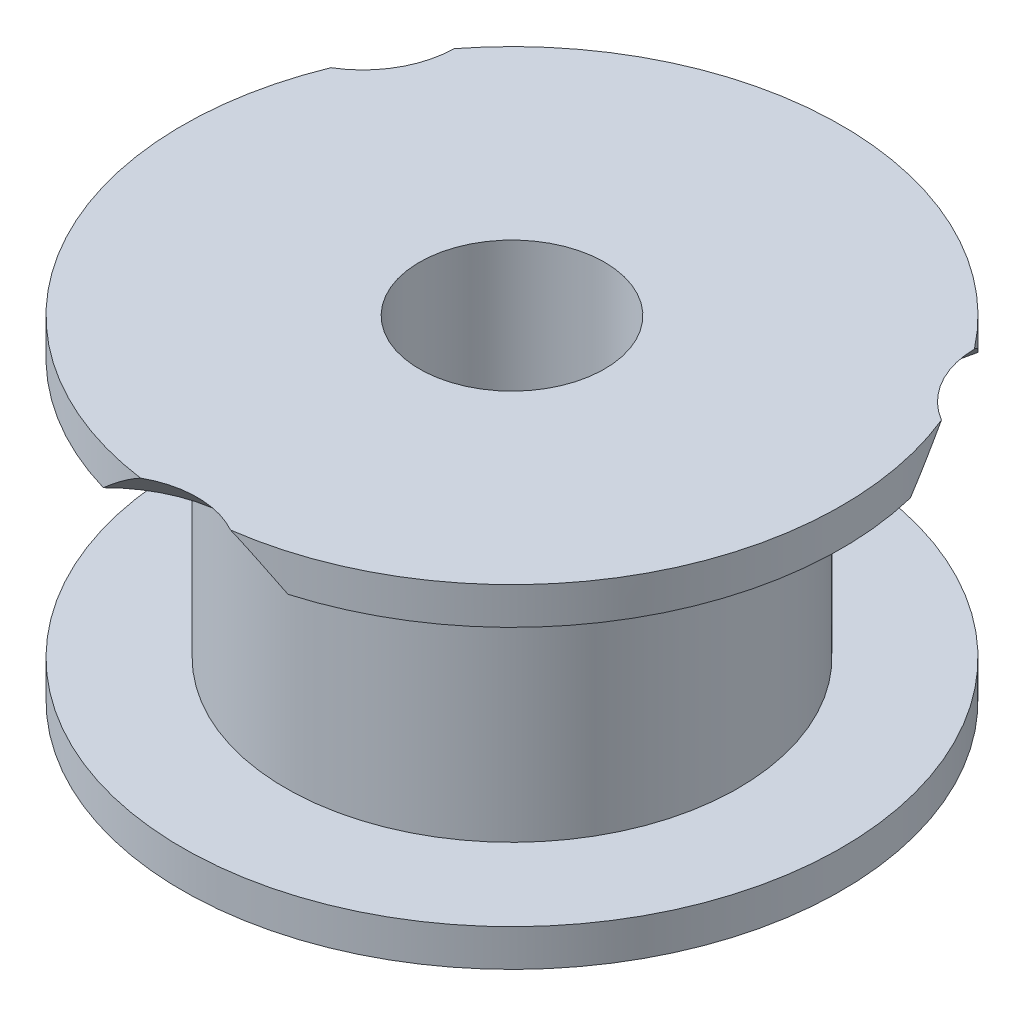
from build123d import *

# Parameters (mm, degrees)
ENL_V_MAT_EXTRU_1_REACH = 16.914
ESQUISSE2_R             = 2.5
CHANFREIN1_SIZE         = 1


with BuildPart() as part:
    # Esquisse1 → Révolution1 (revolve)
    with BuildSketch(Plane.XY, mode=Mode.PRIVATE) as r_volution1_sk:
        Polygon((2.5, 0), (8.9, 0), (8.9, 1), (6.11, 1), (6.11, 8), (8.9, 8), (8.9, 9), (2.5, 9), align=None)
    revolve(r_volution1_sk.sketch.rotate(Axis((0, 0, 0), (0, 1, 0)), 90), axis=Axis((0, 0, 0), (0, 1, 0)))

    # Esquisse2 → Enlèv. mat.-Extru.1 (cut, up to next)
    with BuildSketch(Plane.XZ.offset(-8), mode=Mode.PRIVATE) as enl_v_mat_extru_1_sk1:
        with Locations((0, 11)):
            Circle(ESQUISSE2_R)
    enl_v_mat_extru_1_tool1 = extrude(enl_v_mat_extru_1_sk1.sketch, amount=-ENL_V_MAT_EXTRU_1_REACH, mode=Mode.PRIVATE) & part.part
    # Esquisse2 → Enlèv. mat.-Extru.1 (cut, up to next)
    with BuildSketch(Plane.XZ.offset(-8), mode=Mode.PRIVATE) as enl_v_mat_extru_1_sk2:
        with Locations((9.526279442, -5.5)):
            Circle(ESQUISSE2_R)
    enl_v_mat_extru_1_tool2 = extrude(enl_v_mat_extru_1_sk2.sketch, amount=-ENL_V_MAT_EXTRU_1_REACH, mode=Mode.PRIVATE) & part.part
    # Esquisse2 → Enlèv. mat.-Extru.1 (cut, up to next)
    with BuildSketch(Plane.XZ.offset(-8), mode=Mode.PRIVATE) as enl_v_mat_extru_1_sk3:
        with Locations((-9.526279442, -5.5)):
            Circle(ESQUISSE2_R)
    enl_v_mat_extru_1_tool3 = extrude(enl_v_mat_extru_1_sk3.sketch, amount=-ENL_V_MAT_EXTRU_1_REACH, mode=Mode.PRIVATE) & part.part
    add(enl_v_mat_extru_1_tool1.solids().sort_by_distance((0, 8, 11))[0], mode=Mode.SUBTRACT)
    add(enl_v_mat_extru_1_tool2.solids().sort_by_distance((9.526279, 8, -5.5))[0], mode=Mode.SUBTRACT)
    add(enl_v_mat_extru_1_tool3.solids().sort_by_distance((-9.526279, 8, -5.5))[0], mode=Mode.SUBTRACT)

    # Chanfrein1
    chanfrein1_edges = [part.edges().sort_by_distance(p)[0] for p in [
        (7.361215932, 8, -4.25),
        (0, 8, 8.5),
        (-7.361215932, 8, -4.25),
    ]]
    chamfer(chanfrein1_edges, length=CHANFREIN1_SIZE - 0.0001)  # a hair under: the kernel refuses the full size


solid = part.part
